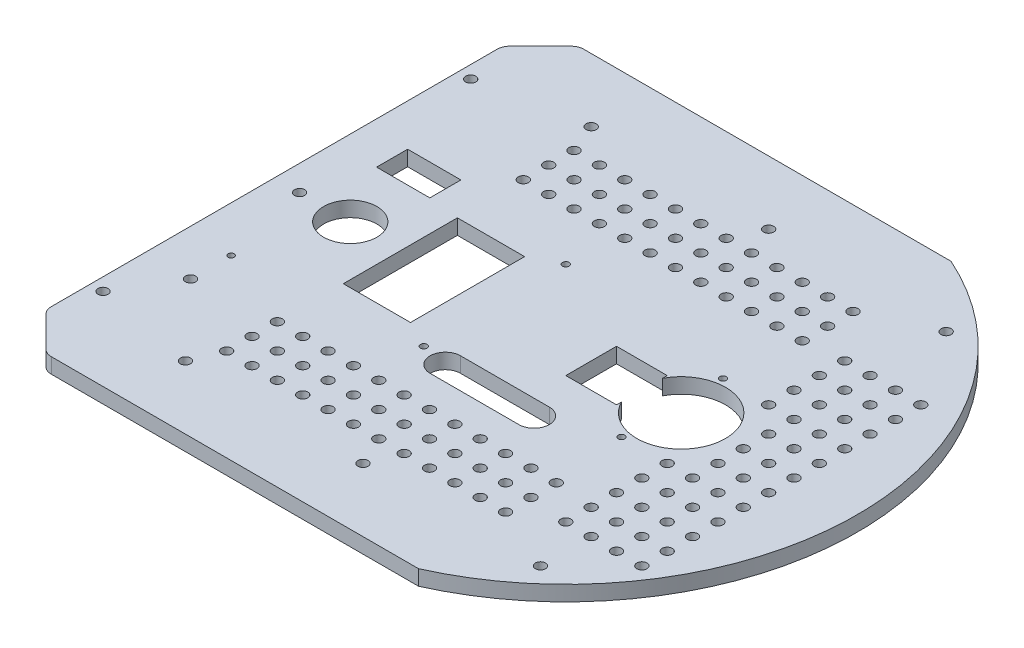
from build123d import *

# Parameters (mm, degrees)
SKETCH1_R           = 2
BOSS_EXTRUDE1_DEPTH = 6
CUT_EXTRUDE1_START  = -10
SKETCH2_R           = 1.3
SKETCH2_R_2         = 10.5
SKETCH2_R_3         = 1.2
SKETCH2_R_4         = 2
SKETCH2_R_5         = 17.5
SKETCH2_W           = 26.5
SKETCH2_H           = 45
CUT_EXTRUDE1_DEPTH  = 10
BOSS_EXTRUDE2_START = -6
BOSS_EXTRUDE2_DEPTH = 6
CHAMFER1_SIZE       = 15
FILLET1_R           = 5
SKETCH4_R           = 2
CUT_EXTRUDE2_DEPTH  = 10
SKETCH5_W           = 21
SKETCH5_H           = 12.25
CUT_EXTRUDE3_DEPTH  = 10
SKETCH6_W           = 20
SKETCH6_H           = 20
CUT_EXTRUDE4_DEPTH  = 10


with BuildPart() as part:
    # Sketch1 → Boss-Extrude1 (new body)
    with BuildSketch(Plane(origin=(0, 0, 0), x_dir=(1, 0, 0), z_dir=(0, 1, 0))):
        with BuildLine():
            Line((-46.904157598, -105), (46.904157598, -105))
            ThreePointArc((46.904157598, -105), (115, 0), (46.904157598, 105))
            Line((46.904157598, 105), (-46.904157598, 105))
            ThreePointArc((-46.904157598, 105), (-115, 0), (-46.904157598, -105))
        make_face()
        with Locations((-70, 80)):
            Circle(SKETCH1_R, mode=Mode.SUBTRACT)
        with Locations((70, 80)):
            Circle(SKETCH1_R, mode=Mode.SUBTRACT)
        with Locations((70, -80)):
            Circle(SKETCH1_R, mode=Mode.SUBTRACT)
        with Locations((-70, -80)):
            Circle(SKETCH1_R, mode=Mode.SUBTRACT)
        with Locations((0, 80)):
            Circle(SKETCH1_R, mode=Mode.SUBTRACT)
        with Locations((70, 0)):
            Circle(SKETCH1_R, mode=Mode.SUBTRACT)
        with Locations((0, -80)):
            Circle(SKETCH1_R, mode=Mode.SUBTRACT)
    extrude(amount=BOSS_EXTRUDE1_DEPTH)

    # Sketch2 → Cut-Extrude1 (cut)
    with BuildSketch(Plane(origin=(0, 6, 0), x_dir=(1, 0, 0), z_dir=(0, 1, 0)).offset(CUT_EXTRUDE1_START)):
        with Locations((-28, 28)):
            Circle(SKETCH2_R)
        with Locations((-28, -28)):
            Circle(SKETCH2_R)
        with Locations((42, 20)):
            Circle(SKETCH2_R)
        with Locations((42, -20)):
            Circle(SKETCH2_R)
        with Locations((-85, 0)):
            Circle(SKETCH2_R_2)
        with Locations((-97, -35)):
            Circle(SKETCH2_R_3)
        with Locations((-97, -51)):
            Circle(SKETCH2_R_4)
        with Locations((-105, 0)):
            Circle(SKETCH2_R_4)
        with Locations((60, 50)):
            Circle(SKETCH2_R_4)
        with Locations((70, 50)):
            Circle(SKETCH2_R_4)
        with Locations((80, 50)):
            Circle(SKETCH2_R_4)
        with Locations((90, 50)):
            Circle(SKETCH2_R_4)
        with Locations((70, 40)):
            Circle(SKETCH2_R_4)
        with Locations((80, 40)):
            Circle(SKETCH2_R_4)
        with Locations((90, 40)):
            Circle(SKETCH2_R_4)
        with Locations((70, 30)):
            Circle(SKETCH2_R_4)
        with Locations((80, 30)):
            Circle(SKETCH2_R_4)
        with Locations((90, 30)):
            Circle(SKETCH2_R_4)
        with Locations((70, 20)):
            Circle(SKETCH2_R_4)
        with Locations((80, 20)):
            Circle(SKETCH2_R_4)
        with Locations((90, 20)):
            Circle(SKETCH2_R_4)
        with Locations((70, 10)):
            Circle(SKETCH2_R_4)
        with Locations((80, 10)):
            Circle(SKETCH2_R_4)
        with Locations((90, 10)):
            Circle(SKETCH2_R_4)
        with Locations((70, 0)):
            Circle(SKETCH2_R_4)
        with Locations((80, 0)):
            Circle(SKETCH2_R_4)
        with Locations((90, 0)):
            Circle(SKETCH2_R_4)
        with Locations((70, -10)):
            Circle(SKETCH2_R_4)
        with Locations((80, -10)):
            Circle(SKETCH2_R_4)
        with Locations((90, -10)):
            Circle(SKETCH2_R_4)
        with Locations((70, -20)):
            Circle(SKETCH2_R_4)
        with Locations((80, -20)):
            Circle(SKETCH2_R_4)
        with Locations((90, -20)):
            Circle(SKETCH2_R_4)
        with Locations((70, -30)):
            Circle(SKETCH2_R_4)
        with Locations((80, -30)):
            Circle(SKETCH2_R_4)
        with Locations((90, -30)):
            Circle(SKETCH2_R_4)
        with Locations((70, -40)):
            Circle(SKETCH2_R_4)
        with Locations((80, -40)):
            Circle(SKETCH2_R_4)
        with Locations((90, -40)):
            Circle(SKETCH2_R_4)
        with Locations((70, -50)):
            Circle(SKETCH2_R_4)
        with Locations((80, -50)):
            Circle(SKETCH2_R_4)
        with Locations((90, -50)):
            Circle(SKETCH2_R_4)
        with Locations((70, -60)):
            Circle(SKETCH2_R_4)
        with Locations((80, -60)):
            Circle(SKETCH2_R_4)
        with Locations((90, -60)):
            Circle(SKETCH2_R_4)
        with Locations((60, 40)):
            Circle(SKETCH2_R_4)
        with Locations((60, 30)):
            Circle(SKETCH2_R_4)
        with Locations((60, 20)):
            Circle(SKETCH2_R_4)
        with Locations((60, -20)):
            Circle(SKETCH2_R_4)
        with Locations((60, -30)):
            Circle(SKETCH2_R_4)
        with Locations((60, -40)):
            Circle(SKETCH2_R_4)
        with Locations((60, -50)):
            Circle(SKETCH2_R_4)
        with Locations((60, -60)):
            Circle(SKETCH2_R_4)
        with Locations((-65.25, -68.5)):
            Circle(SKETCH2_R_4)
        with Locations((34.75, 48.5)):
            Circle(SKETCH2_R_4)
        with Locations((-55.25, -68.5)):
            Circle(SKETCH2_R_4)
        with Locations((-45.25, -68.5)):
            Circle(SKETCH2_R_4)
        with Locations((-35.25, -68.5)):
            Circle(SKETCH2_R_4)
        with Locations((-25.25, -68.5)):
            Circle(SKETCH2_R_4)
        with Locations((-15.25, -68.5)):
            Circle(SKETCH2_R_4)
        with Locations((-5.25, -68.5)):
            Circle(SKETCH2_R_4)
        with Locations((4.75, -68.5)):
            Circle(SKETCH2_R_4)
        with Locations((14.75, -68.5)):
            Circle(SKETCH2_R_4)
        with Locations((24.75, -68.5)):
            Circle(SKETCH2_R_4)
        with Locations((34.75, -68.5)):
            Circle(SKETCH2_R_4)
        with Locations((44.75, -68.5)):
            Circle(SKETCH2_R_4)
        with Locations((-55.25, -58.5)):
            Circle(SKETCH2_R_4)
        with Locations((-45.25, -58.5)):
            Circle(SKETCH2_R_4)
        with Locations((-35.25, -58.5)):
            Circle(SKETCH2_R_4)
        with Locations((-25.25, -58.5)):
            Circle(SKETCH2_R_4)
        with Locations((-15.25, -58.5)):
            Circle(SKETCH2_R_4)
        with Locations((-5.25, -58.5)):
            Circle(SKETCH2_R_4)
        with Locations((4.75, -58.5)):
            Circle(SKETCH2_R_4)
        with Locations((14.75, -58.5)):
            Circle(SKETCH2_R_4)
        with Locations((24.75, -58.5)):
            Circle(SKETCH2_R_4)
        with Locations((34.75, -58.5)):
            Circle(SKETCH2_R_4)
        with Locations((44.75, -58.5)):
            Circle(SKETCH2_R_4)
        with Locations((-55.25, -48.5)):
            Circle(SKETCH2_R_4)
        with Locations((-45.25, -48.5)):
            Circle(SKETCH2_R_4)
        with Locations((-35.25, -48.5)):
            Circle(SKETCH2_R_4)
        with Locations((-25.25, -48.5)):
            Circle(SKETCH2_R_4)
        with Locations((-15.25, -48.5)):
            Circle(SKETCH2_R_4)
        with Locations((-5.25, -48.5)):
            Circle(SKETCH2_R_4)
        with Locations((4.75, -48.5)):
            Circle(SKETCH2_R_4)
        with Locations((14.75, -48.5)):
            Circle(SKETCH2_R_4)
        with Locations((24.75, -48.5)):
            Circle(SKETCH2_R_4)
        with Locations((34.75, -48.5)):
            Circle(SKETCH2_R_4)
        with Locations((44.75, -48.5)):
            Circle(SKETCH2_R_4)
        with Locations((-65.25, -58.5)):
            Circle(SKETCH2_R_4)
        with Locations((-65.25, -48.5)):
            Circle(SKETCH2_R_4)
        with Locations((44.75, 48.5)):
            Circle(SKETCH2_R_4)
        with Locations((44.75, 58.5)):
            Circle(SKETCH2_R_4)
        with Locations((34.75, 58.5)):
            Circle(SKETCH2_R_4)
        with Locations((34.75, 68.5)):
            Circle(SKETCH2_R_4)
        with Locations((44.75, 68.5)):
            Circle(SKETCH2_R_4)
        with Locations((24.75, 48.5)):
            Circle(SKETCH2_R_4)
        with Locations((24.75, 58.5)):
            Circle(SKETCH2_R_4)
        with Locations((24.75, 68.5)):
            Circle(SKETCH2_R_4)
        with Locations((14.75, 68.5)):
            Circle(SKETCH2_R_4)
        with Locations((14.75, 58.5)):
            Circle(SKETCH2_R_4)
        with Locations((14.75, 48.5)):
            Circle(SKETCH2_R_4)
        with Locations((4.75, 48.5)):
            Circle(SKETCH2_R_4)
        with Locations((4.75, 58.5)):
            Circle(SKETCH2_R_4)
        with Locations((4.75, 68.5)):
            Circle(SKETCH2_R_4)
        with Locations((-5.25, 68.5)):
            Circle(SKETCH2_R_4)
        with Locations((-5.25, 58.5)):
            Circle(SKETCH2_R_4)
        with Locations((-5.25, 48.5)):
            Circle(SKETCH2_R_4)
        with Locations((-15.25, 48.5)):
            Circle(SKETCH2_R_4)
        with Locations((-15.25, 58.5)):
            Circle(SKETCH2_R_4)
        with Locations((-15.25, 68.5)):
            Circle(SKETCH2_R_4)
        with Locations((-25.25, 68.5)):
            Circle(SKETCH2_R_4)
        with Locations((-25.25, 58.5)):
            Circle(SKETCH2_R_4)
        with Locations((-25.25, 48.5)):
            Circle(SKETCH2_R_4)
        with Locations((-35.25, 48.5)):
            Circle(SKETCH2_R_4)
        with Locations((-35.25, 68.5)):
            Circle(SKETCH2_R_4)
        with Locations((-35.25, 58.5)):
            Circle(SKETCH2_R_4)
        with Locations((-45.25, 68.5)):
            Circle(SKETCH2_R_4)
        with Locations((-45.25, 58.5)):
            Circle(SKETCH2_R_4)
        with Locations((-45.25, 48.5)):
            Circle(SKETCH2_R_4)
        with Locations((-55.25, 48.5)):
            Circle(SKETCH2_R_4)
        with Locations((-55.25, 58.5)):
            Circle(SKETCH2_R_4)
        with Locations((-55.25, 68.5)):
            Circle(SKETCH2_R_4)
        with Locations((-65.25, 68.5)):
            Circle(SKETCH2_R_4)
        with Locations((-65.25, 48.5)):
            Circle(SKETCH2_R_4)
        with Locations((-65.25, 58.5)):
            Circle(SKETCH2_R_4)
        with Locations((45.5, 0)):
            Circle(SKETCH2_R_5)
        with Locations((-52, 0)):
            Rectangle(SKETCH2_W, SKETCH2_H)
        with BuildLine():
            Line((-17.5, -24), (17.5, -24))
            ThreePointArc((17.5, -24), (23.5, -30), (17.5, -36))
            Line((17.5, -36), (-17.5, -36))
            ThreePointArc((-17.5, -36), (-23.5, -30), (-17.5, -24))
        make_face()
    extrude(amount=CUT_EXTRUDE1_DEPTH, mode=Mode.SUBTRACT)

    # Sketch3 → Boss-Extrude2 (add)
    with BuildSketch(Plane(origin=(0, 6, 0), x_dir=(1, 0, 0), z_dir=(0, 1, 0)).offset(BOSS_EXTRUDE2_START)):
        with BuildLine():
            ThreePointArc((-115, 0), (-96.485693561, 62.574043645), (-46.904157598, 105))
            Line((-46.904157598, 105), (-115, 105))
            Line((-115, 105), (-115, 0))
        make_face()
        with BuildLine():
            ThreePointArc((-46.904157598, -105), (-96.485693561, -62.574043645), (-115, 0))
            Line((-115, 0), (-115, -105))
            Line((-115, -105), (-46.904157598, -105))
        make_face()
    extrude(amount=BOSS_EXTRUDE2_DEPTH)

    # Chamfer1
    chamfer1_edges = [part.edges().sort_by_distance(p)[0] for p in [
        (-115, 3, -105),
        (-115, 3, 105),
    ]]
    chamfer(chamfer1_edges, length=CHAMFER1_SIZE)

    # Fillet1
    fillet1_edges = [part.edges().sort_by_distance(p)[0] for p in [
        (-100, 3, 105),
        (-115, 3, 90),
        (-115, 3, -90),
        (-100, 3, -105),
    ]]
    fillet(fillet1_edges, radius=FILLET1_R)

    # Sketch4 → Cut-Extrude2 (cut)
    with BuildSketch(Plane(origin=(0, 6, 0), x_dir=(1, 0, 0), z_dir=(0, 1, 0))):
        with Locations((-110, 72.5)):
            Circle(SKETCH4_R)
        with Locations((-110, -72.5)):
            Circle(SKETCH4_R)
    extrude(amount=-CUT_EXTRUDE2_DEPTH, mode=Mode.SUBTRACT)

    # Sketch5 → Cut-Extrude3 (cut)
    with BuildSketch(Plane(origin=(0, 6, 0), x_dir=(1, 0, 0), z_dir=(0, 1, 0))):
        with Locations((-88, 30)):
            Rectangle(SKETCH5_W, SKETCH5_H)
    extrude(amount=-CUT_EXTRUDE3_DEPTH, mode=Mode.SUBTRACT)

    # Sketch6 → Cut-Extrude4 (cut)
    with BuildSketch(Plane(origin=(0, 6, 0), x_dir=(1, 0, 0), z_dir=(0, 1, 0))):
        with Locations((20, 0)):
            Rectangle(SKETCH6_W, SKETCH6_H)
    extrude(amount=-CUT_EXTRUDE4_DEPTH, mode=Mode.SUBTRACT)


solid = part.part
